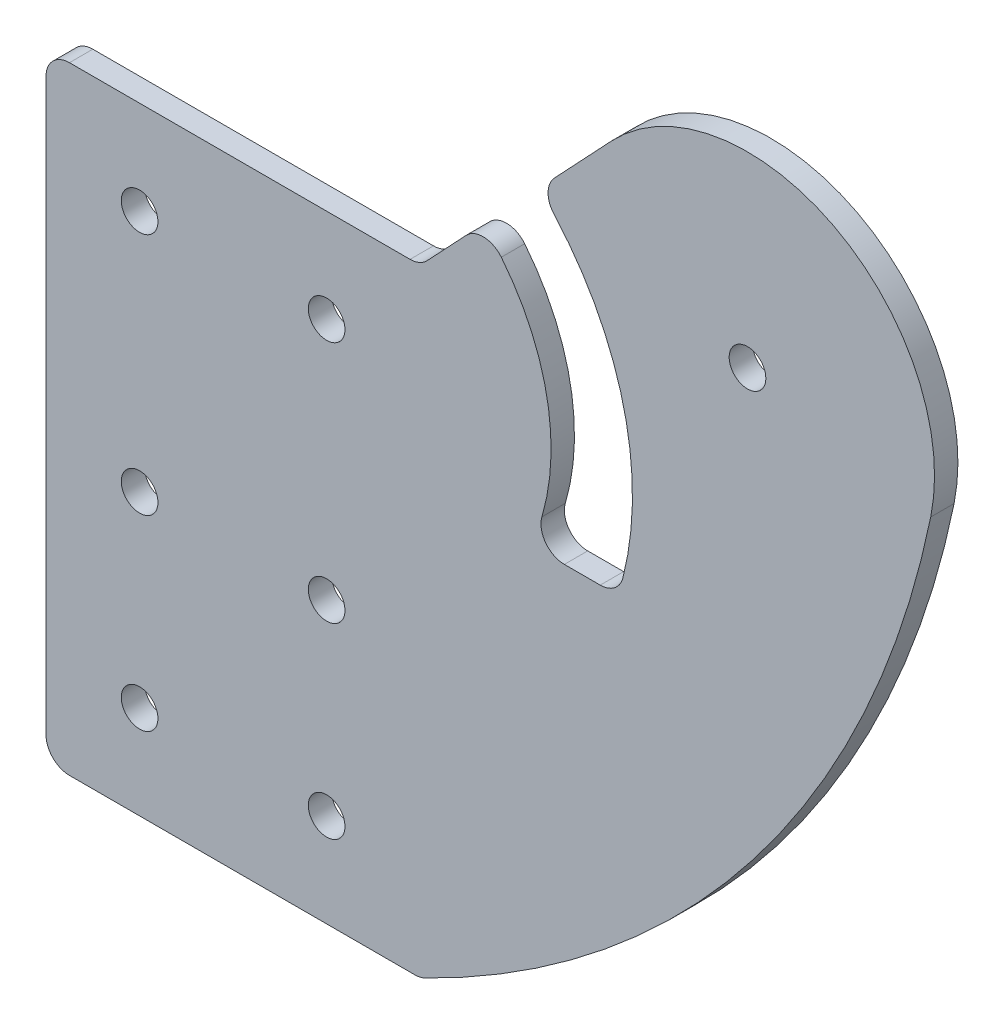
from build123d import *

# Parameters (mm, degrees)
SKETCH2_R           = 2.4892
BOSS_EXTRUDE1_DEPTH = 3.175
SKETCH3_R           = 2.4892
CUT_EXTRUDE1_DEPTH  = 170.758910002
FILLET1_R           = 3.175


with BuildPart() as part:
    # Sketch2 → Boss-Extrude1 (new body)
    with BuildSketch(Plane.XY):
        with BuildLine():
            Line((50.8, 83.82), (59.118653734, 92.65614519))
            Line((59.118653734, 92.65614519), (59.383962839, 92.937958792))
            ThreePointArc((59.383962839, 92.937958792), (68.065457278, 76.6968961), (65.808128771, 58.42))
            Line((65.808128771, 58.42), (77.639446645, 58.42))
            ThreePointArc((77.639446645, 58.42), (78.38013064, 81.227864099), (66.958536488, 100.983735747))
            Line((66.958536488, 100.983735747), (76.756103851, 111.390795652))
            ThreePointArc((76.756103851, 111.390795652), (106.956686726, 116.52137276), (120.129661362, 88.865075707))
            ThreePointArc((120.129661362, 88.865075707), (95.863003686, 36.320219178), (50.8, 0))
            Line((50.8, 0), (0, 0))
            Line((0, 0), (0, 83.82))
            Line((0, 83.82), (50.8, 83.82))
        make_face()
        with Locations((95.25, 93.98)):
            Circle(SKETCH2_R, mode=Mode.SUBTRACT)
    extrude(amount=-BOSS_EXTRUDE1_DEPTH)

    # Sketch3 → Cut-Extrude1 (cut, through all)
    with BuildSketch(Plane.XY):
        with Locations((12.7, 71.12)):
            Circle(SKETCH3_R)
        with Locations((38.1, 71.12)):
            Circle(SKETCH3_R)
        with Locations((12.7, 38.1)):
            Circle(SKETCH3_R)
        with Locations((12.7, 12.7)):
            Circle(SKETCH3_R)
        with Locations((12.7, -12.7)):
            Circle(SKETCH3_R)
        with Locations((12.7, -38.1)):
            Circle(SKETCH3_R)
        with Locations((12.7, -63.5)):
            Circle(SKETCH3_R)
        with Locations((38.1, 12.7)):
            Circle(SKETCH3_R)
        with Locations((38.1, -12.7)):
            Circle(SKETCH3_R)
        with Locations((38.1, -38.1)):
            Circle(SKETCH3_R)
        with Locations((38.1, -63.5)):
            Circle(SKETCH3_R)
        with Locations((38.1, 38.1)):
            Circle(SKETCH3_R)
    extrude(amount=-CUT_EXTRUDE1_DEPTH, mode=Mode.SUBTRACT)

    # Fillet1
    fillet1_edges = [part.edges().sort_by_distance(p)[0] for p in [
        (0, 0, -1.5875),
        (50.8, 83.82, -1.5875),
        (0, 83.82, -1.5875),
        (50.8, 0, -1.5875),
        (77.639446645, 58.42, -1.5875),
        (65.808128771, 58.42, -1.5875),
        (59.383962839, 92.937958792, -1.5875),
        (66.958536488, 100.983735747, -1.5875),
    ]]
    fillet(fillet1_edges, radius=FILLET1_R)


solid = part.part
